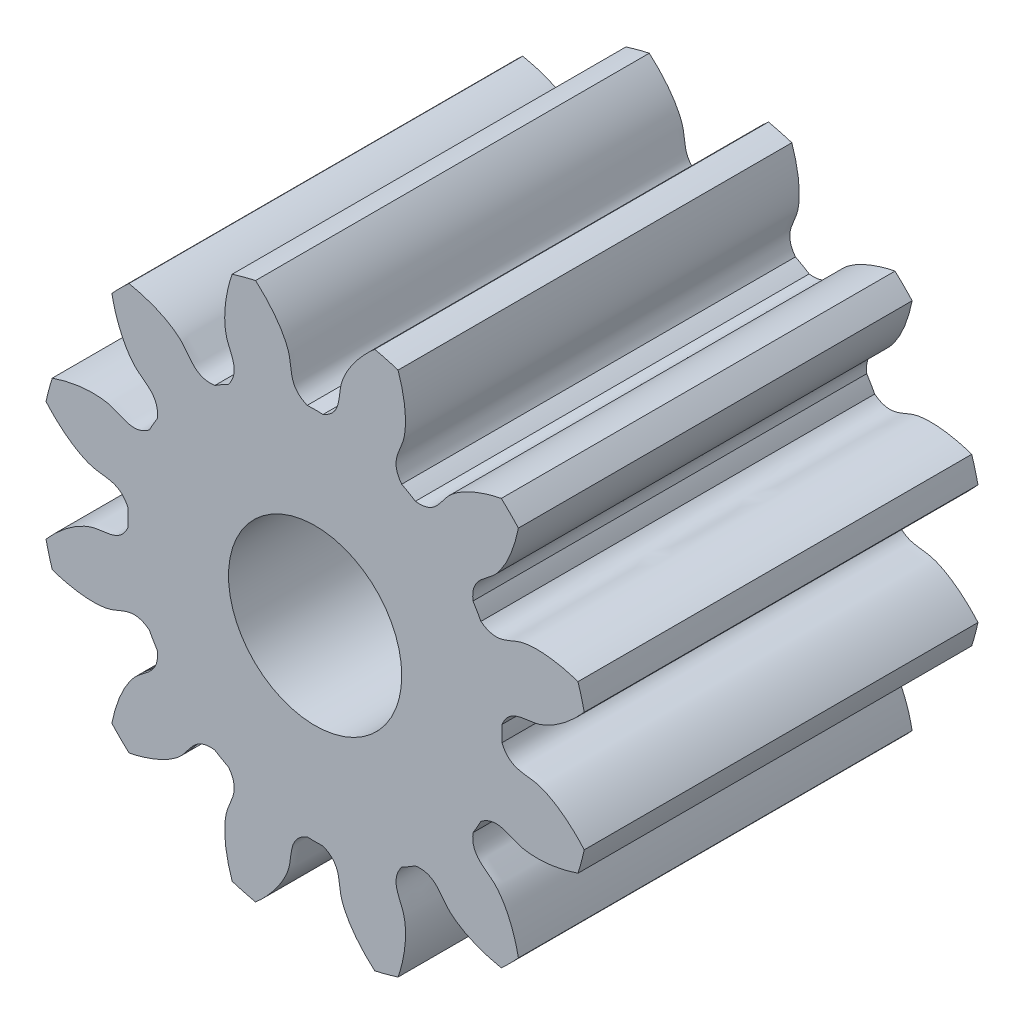
from build123d import *

# Parameters (mm, degrees)
SKETCH_1_R               = 3.5
EXTRUDE_1_DEPTH          = 5
CUT_EXTRUDE_1_DEPTH      = 8.03562364
PATTERN_CIRCULAR_1_COUNT = 12
CUT_EXTRUDE_2_REACH      = 8.954
SKETCH_4_R               = 1.1


with BuildPart() as part:
    # 草图1 → 凸台-拉伸1 (new body)
    with BuildSketch(Plane.XY):
        Circle(SKETCH_1_R)
    extrude(amount=EXTRUDE_1_DEPTH)

    # 草图2 → 切除-拉伸1 (cut, through all)
    with BuildSketch(Plane.XY):
        with BuildLine():
            ThreePointArc((0.100420056, 2.372876063), (0, 2.375), (-0.100420056, 2.372876063))
            add(Edge.make_bspline(
                [(-0.100420056, 2.372876063), (-0.340394435, 2.474653731), (-0.287186739, 2.672409341), (-0.338076094, 2.844740289), (-0.341311927, 2.854952869), (-0.345113625, 2.866166713), (-0.349521434, 2.878363044), (-0.354576313, 2.891521619), (-0.360318258, 2.905621034), (-0.36678678, 2.920638648), (-0.374020716, 2.936550626), (-0.382058239, 2.95333195), (-0.390936819, 2.970956436), (-0.400693193, 2.989396753), (-0.411363332, 3.008624444), (-0.422982412, 3.02860994), (-0.435584786, 3.049322589), (-0.449203949, 3.07073067), (-0.463872517, 3.092801417), (-0.479622192, 3.115501045), (-0.496483738, 3.138794769), (-0.514486952, 3.162646832), (-0.533660639, 3.187020528), (-0.554032585, 3.211878226), (-0.575629533, 3.237181399), (-0.598477155, 3.262890651), (-0.622600033, 3.288965742), (-0.648021632, 3.315365616), (-0.674764279, 3.342048434), (-0.702849139, 3.368971597), (-0.732296196, 3.396091781), (-0.763124233, 3.423364967), (-0.795350811, 3.450746465), (-0.828992247, 3.478190957), (-0.864063604, 3.505652518), (-0.900578664, 3.533084654), (-0.938549918, 3.560440334), (-0.977988547, 3.587672024), (-1.01890441, 3.614731718), (-1.061306025, 3.641570973), (-1.10520056, 3.668140947), (-1.150593819, 3.694392428), (-1.197490231, 3.720275872), (-1.245892835, 3.74574144), (-1.295803277, 3.770739031), (-1.347221796, 3.79521832), (-1.400147219, 3.819128792), (-1.454576948, 3.842419781), (-1.510506963, 3.865040505), (-1.567931802, 3.886940103), (-1.647189853, 3.915363979), (-1.7077968, 3.935050704), (-1.748802701, 3.947485455)],
                knots=[0, 0, 0, 0, 0.218015236, 0.222043642, 0.226545979, 0.231522246, 0.236972443, 0.24289657, 0.249294627, 0.256166614, 0.263512532, 0.271332379, 0.279626157, 0.288393865, 0.297635503, 0.307351072, 0.31754057, 0.328203999, 0.339341357, 0.350952646, 0.363037866, 0.375597015, 0.388630094, 0.402137104, 0.416118043, 0.430572913, 0.445501713, 0.460904444, 0.476781104, 0.493131694, 0.509956215, 0.527254666, 0.545027047, 0.563273358, 0.581993599, 0.601187771, 0.620855872, 0.640997904, 0.661613866, 0.682703758, 0.704267581, 0.726305333, 0.748817015, 0.771802628, 0.795262171, 0.819195644, 0.843603047, 0.868484381, 0.893839644, 0.919668838, 0.945971962, 1, 1, 1, 1], degree=3))
            ThreePointArc((-1.748802701, 3.947485455), (0, 4.317516914), (1.748802701, 3.947485455))
            add(Edge.make_bspline(
                [(0.100420056, 2.372876063), (0.340394435, 2.474653731), (0.287186739, 2.672409341), (0.338076094, 2.844740289), (0.341311927, 2.854952869), (0.345113625, 2.866166713), (0.349521434, 2.878363044), (0.354576313, 2.891521619), (0.360318258, 2.905621034), (0.36678678, 2.920638648), (0.374020716, 2.936550626), (0.382058239, 2.95333195), (0.390936819, 2.970956436), (0.400693193, 2.989396753), (0.411363332, 3.008624444), (0.422982412, 3.02860994), (0.435584786, 3.049322589), (0.449203949, 3.07073067), (0.463872517, 3.092801417), (0.479622192, 3.115501045), (0.496483738, 3.138794769), (0.514486952, 3.162646832), (0.533660639, 3.187020528), (0.554032585, 3.211878226), (0.575629533, 3.237181399), (0.598477155, 3.262890651), (0.622600033, 3.288965742), (0.648021632, 3.315365616), (0.674764279, 3.342048434), (0.702849139, 3.368971597), (0.732296196, 3.396091781), (0.763124233, 3.423364967), (0.795350811, 3.450746465), (0.828992247, 3.478190957), (0.864063604, 3.505652518), (0.900578664, 3.533084654), (0.938549918, 3.560440334), (0.977988547, 3.587672024), (1.01890441, 3.614731718), (1.061306025, 3.641570973), (1.10520056, 3.668140947), (1.150593819, 3.694392428), (1.197490231, 3.720275872), (1.245892835, 3.74574144), (1.295803277, 3.770739031), (1.347221796, 3.79521832), (1.400147219, 3.819128792), (1.454576948, 3.842419781), (1.510506963, 3.865040505), (1.567931802, 3.886940103), (1.647189853, 3.915363979), (1.7077968, 3.935050704), (1.748802701, 3.947485455)],
                knots=[0, 0, 0, 0, 0.218015236, 0.222043642, 0.226545979, 0.231522246, 0.236972443, 0.24289657, 0.249294627, 0.256166614, 0.263512532, 0.271332379, 0.279626157, 0.288393865, 0.297635503, 0.307351072, 0.31754057, 0.328203999, 0.339341357, 0.350952646, 0.363037866, 0.375597015, 0.388630094, 0.402137104, 0.416118043, 0.430572913, 0.445501713, 0.460904444, 0.476781104, 0.493131694, 0.509956215, 0.527254666, 0.545027047, 0.563273358, 0.581993599, 0.601187771, 0.620855872, 0.640997904, 0.661613866, 0.682703758, 0.704267581, 0.726305333, 0.748817015, 0.771802628, 0.795262171, 0.819195644, 0.843603047, 0.868484381, 0.893839644, 0.919668838, 0.945971962, 1, 1, 1, 1], degree=3))
        make_face()
    cut_extrude_1 = extrude(amount=CUT_EXTRUDE_1_DEPTH, mode=Mode.SUBTRACT)

    # 阵列(圆周)1: 切除-拉伸1 ×12 about axis
    pattern_circular_1_axis = Axis((0, 0, 5), (0, 0, -1))
    for i in range(1, PATTERN_CIRCULAR_1_COUNT):
        add(cut_extrude_1.rotate(pattern_circular_1_axis, i * 360 / PATTERN_CIRCULAR_1_COUNT), mode=Mode.SUBTRACT)

    # 草图4 → 切除-拉伸2 (cut, up to next)
    with BuildSketch(Plane.XY.offset(5), mode=Mode.PRIVATE) as cut_extrude_2_sk1:
        Circle(SKETCH_4_R)
    cut_extrude_2_tool1 = extrude(cut_extrude_2_sk1.sketch, amount=-CUT_EXTRUDE_2_REACH, mode=Mode.PRIVATE) & part.part
    add(cut_extrude_2_tool1.solids().sort_by_distance((0, 0, 5))[0], mode=Mode.SUBTRACT)


solid = part.part
